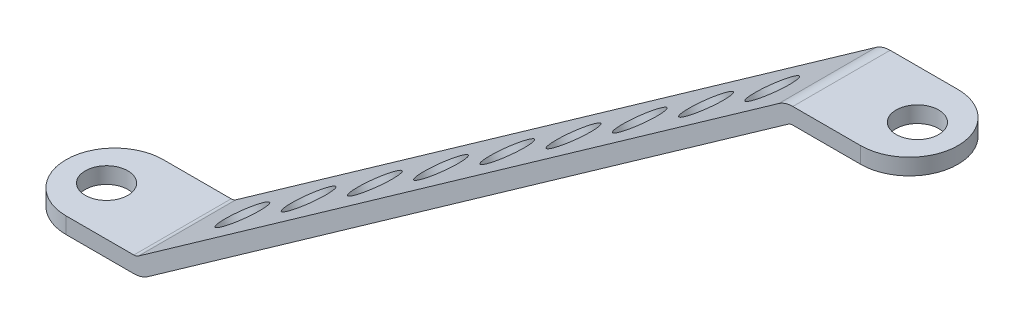
from build123d import *

# Parameters (mm, degrees)
EXTRUDE_THIN1_DEPTH = 4.8
SKETCH2_R           = 2.1
CUT_EXTRUDE1_DEPTH  = 100.04584797
SKETCH3_R           = 2.1
CUT_EXTRUDE2_DEPTH  = 100.786171387
FILLET1_R           = 4.8
SKETCH4_R           = 2.1
CUT_EXTRUDE3_DEPTH  = 99.787603571
LPATTERN1_COUNT     = 5
LPATTERN1_PITCH     = 8
LPATTERN2_COUNT     = 5
LPATTERN2_PITCH     = 8


with BuildPart() as part:
    # Sketch1 → Extrude-Thin1 (new body)
    with BuildSketch(Plane.XY):
        with BuildLine():
            Line((0, -0.8), (11.491963677, -0.8))
            ThreePointArc((11.491963677, -0.8), (12.218283231, -0.687457083), (12.87648435, -0.360383255))
            Line((12.87648435, -0.360383255), (76.046529432, 44.253461085))
            ThreePointArc((76.046529432, 44.253461085), (76.265929805, 44.362485694), (76.508036323, 44.4))
            Line((76.508036323, 44.4), (88, 44.4))
            Line((88, 44.4), (88, 46))
            Line((88, 46), (76.508036323, 46))
            ThreePointArc((76.508036323, 46), (75.781716769, 45.887457083), (75.12351565, 45.560383255))
            Line((75.12351565, 45.560383255), (11.953470568, 0.946538915))
            ThreePointArc((11.953470568, 0.946538915), (11.734070195, 0.837514306), (11.491963677, 0.8))
            Line((11.491963677, 0.8), (0, 0.8))
            Line((0, 0.8), (0, -0.8))
        make_face()
    extrude(amount=EXTRUDE_THIN1_DEPTH)

    # Sketch2 → Cut-Extrude1 (cut, through all)
    with BuildSketch(Plane(origin=(0, 0.8, 0), x_dir=(1, 0, 0), z_dir=(0, 1, 0))):
        with Locations((4, 0)):
            Circle(SKETCH2_R)
    extrude(amount=-CUT_EXTRUDE1_DEPTH, mode=Mode.SUBTRACT)

    # Sketch3 → Cut-Extrude2 (cut, through all)
    with BuildSketch(Plane(origin=(0, 46, 0), x_dir=(1, 0, 0), z_dir=(0, 1, 0))):
        with Locations((84, 0)):
            Circle(SKETCH3_R)
    extrude(amount=-CUT_EXTRUDE2_DEPTH, mode=Mode.SUBTRACT)

    # Fillet1
    fillet1_edges = [part.edges().sort_by_distance(p)[0] for p in [
        (0, 0, 4.8),
        (88, 45.2, 4.8),
    ]]
    fillet(fillet1_edges, radius=FILLET1_R - 0.0001)  # a hair under: the kernel refuses the full size

    # Sketch4 → Cut-Extrude3 (cut, through all)
    with BuildSketch(Plane(origin=(3.532029558, -5.001103798, 0), x_dir=(0.816826356052519, 0.5768836139620918, 0), z_dir=(-0.5768836139620916, 0.8168263560525189, 0))):
        with Locations((48.977929342, 0)):
            Circle(SKETCH4_R)
    cut_extrude3 = extrude(amount=-CUT_EXTRUDE3_DEPTH, mode=Mode.SUBTRACT)

    # LPattern1: Cut-Extrude3 ×5
    with Locations(*[Vector(0.8168263560525189, 0.5768836139620918, 0) * (i * LPATTERN1_PITCH) for i in range(1, LPATTERN1_COUNT)]):
        add(cut_extrude3, mode=Mode.SUBTRACT)

    # LPattern2: Cut-Extrude3 ×5
    with Locations(*[Vector(-0.8168263560525189, -0.5768836139620918, 0) * (i * LPATTERN2_PITCH) for i in range(1, LPATTERN2_COUNT)]):
        add(cut_extrude3, mode=Mode.SUBTRACT)

    # Mirror1: part across plane


with BuildPart() as part_1:
    add(part.part)
    add(part.part.mirror(Plane(origin=(76.508036323, 43.6, 0), x_dir=(1, 0, 0), z_dir=(0, 0, 1))))


solid = part_1.part
